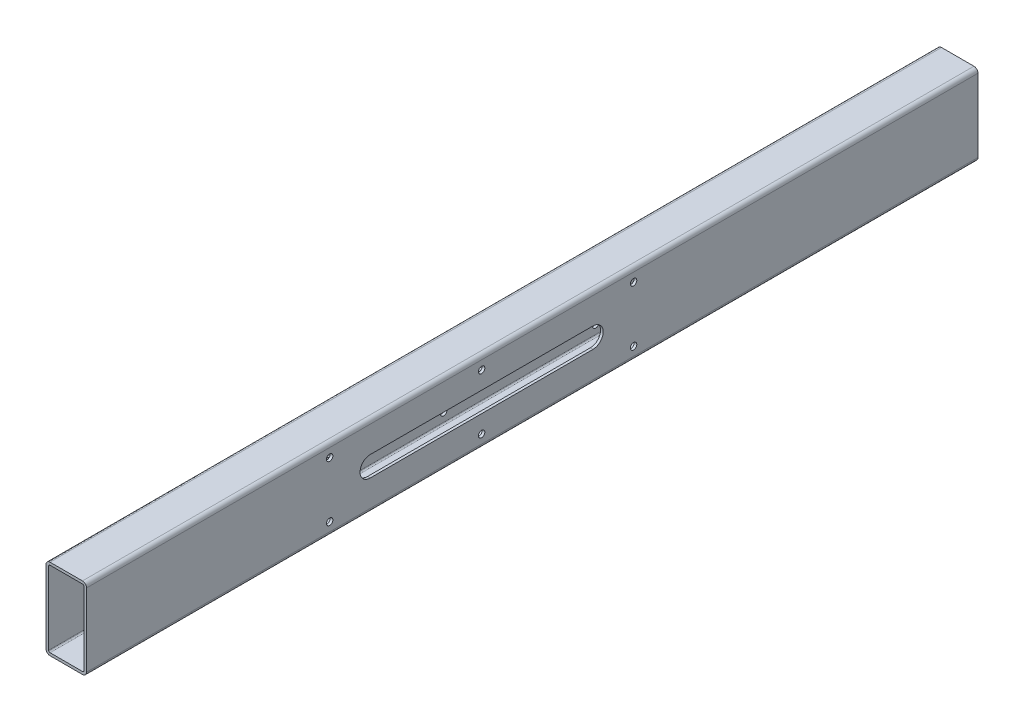
from build123d import *

# Parameters (mm, degrees)
EXTRUDE_THIN1_DEPTH = 279.4
CUT_EXTRUDE2_DEPTH  = 282.699627263
SKETCH5_R           = 2.0193
CUT_EXTRUDE3_DEPTH  = 282.699627263


with BuildPart() as part:
    # Sketch1 → Extrude-Thin1 (new, symmetric)
    with BuildSketch(Plane.XY):
        with BuildLine():
            Line((-10.16, 25.4), (10.16, 25.4))
            ThreePointArc((10.16, 25.4), (11.956051224, 24.656051224), (12.7, 22.86))
            Line((12.7, 22.86), (12.7, -22.86))
            ThreePointArc((12.7, -22.86), (11.956051224, -24.656051224), (10.16, -25.4))
            Line((10.16, -25.4), (-10.16, -25.4))
            ThreePointArc((-10.16, -25.4), (-11.956051224, -24.656051224), (-12.7, -22.86))
            Line((-12.7, -22.86), (-12.7, 22.86))
            ThreePointArc((-12.7, 22.86), (-11.956051224, 24.656051224), (-10.16, 25.4))
        make_face()
        with BuildLine():
            Line((-10.16, 23.749), (10.16, 23.749))
            ThreePointArc((10.16, 23.749), (10.788617928, 23.488617928), (11.049, 22.86))
            Line((11.049, 22.86), (11.049, -22.86))
            ThreePointArc((11.049, -22.86), (10.788617928, -23.488617928), (10.16, -23.749))
            Line((10.16, -23.749), (-10.16, -23.749))
            ThreePointArc((-10.16, -23.749), (-10.788617928, -23.488617928), (-11.049, -22.86))
            Line((-11.049, -22.86), (-11.049, 22.86))
            ThreePointArc((-11.049, 22.86), (-10.788617928, 23.488617928), (-10.16, 23.749))
        make_face(mode=Mode.SUBTRACT)
    extrude(amount=EXTRUDE_THIN1_DEPTH, both=True)

    # Sketch3 → Cut-Extrude2 (cut, through all)
    with BuildSketch(Plane.ZY.offset(12.7)):
        with BuildLine():
            Line((101.6, -6.35), (-38.1, -6.35))
            ThreePointArc((-38.1, -6.35), (-44.45, 0), (-38.1, 6.35))
            Line((-38.1, 6.35), (101.6, 6.35))
            ThreePointArc((101.6, 6.35), (107.95, 0), (101.6, -6.35))
        make_face()
    extrude(amount=-CUT_EXTRUDE2_DEPTH, mode=Mode.SUBTRACT)

    # Sketch5 → Cut-Extrude3 (cut, through all)
    with BuildSketch(Plane(origin=(12.7, 0, 0), x_dir=(0, 0, -1), z_dir=(1, 0, 0))):
        with Locations((63.5, 17.399)):
            Circle(SKETCH5_R)
        with Locations((63.5, -17.399)):
            Circle(SKETCH5_R)
        with Locations((-31.75, 17.399)):
            Circle(SKETCH5_R)
        with Locations((-31.75, -17.399)):
            Circle(SKETCH5_R)
        with Locations((-127, -17.399)):
            Circle(SKETCH5_R)
        with Locations((-127, 17.399)):
            Circle(SKETCH5_R)
    extrude(amount=-CUT_EXTRUDE3_DEPTH, mode=Mode.SUBTRACT)


solid = part.part
